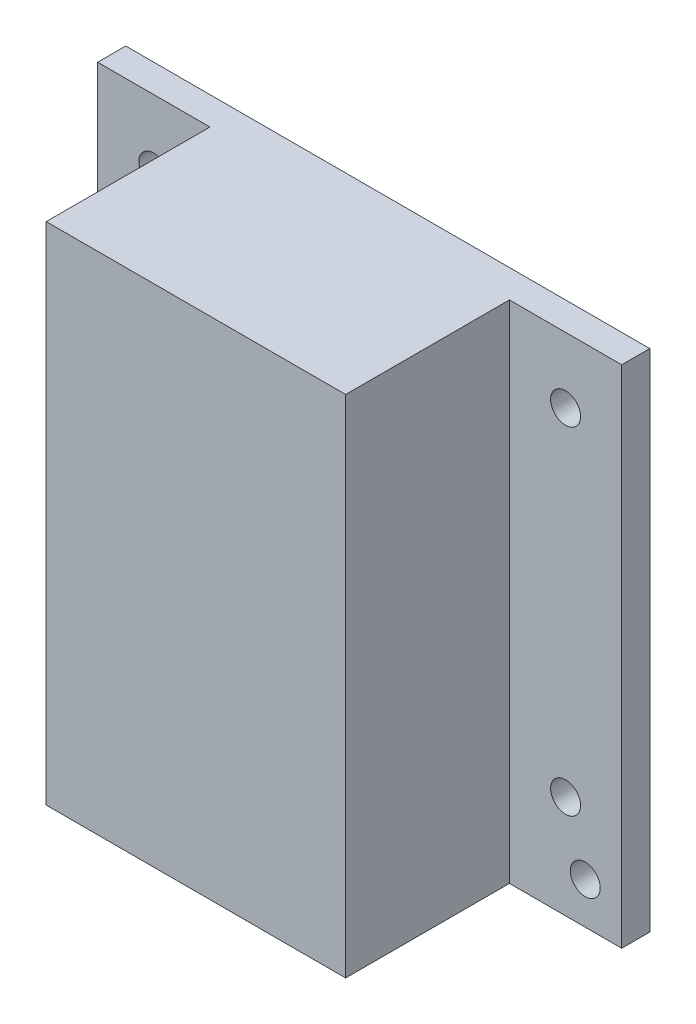
from build123d import *

# Parameters (mm, degrees)
SKETCH1_W           = 132
SKETCH1_H           = 160
BOSS_EXTRUDE1_DEPTH = 6
SKETCH3_W           = 32
SKETCH3_H           = 54
SKETCH3_W_2         = 26
SKETCH3_H_2         = 48
BOSS_EXTRUDE2_DEPTH = 17.5
SKETCH4_W           = 32
SKETCH4_H           = 54
BOSS_EXTRUDE3_DEPTH = 3
SKETCH5_W           = 25
SKETCH5_H           = 17
CUT_EXTRUDE1_DEPTH  = 3
SKETCH6_W           = 12
SKETCH6_H           = 54
BOSS_EXTRUDE4_DEPTH = 3
SKETCH7_R           = 1.6
CUT_EXTRUDE2_DEPTH  = 106.177231376
SKETCH8_W           = 3
SKETCH8_H           = 6.5
BOSS_EXTRUDE5_DEPTH = 20
SKETCH9_R           = 1.55
CUT_EXTRUDE3_DEPTH  = 6
SKETCH10_R          = 1.6
CUT_EXTRUDE4_DEPTH  = 108.043215572
SKETCH11_W          = 2.5
SKETCH11_H          = 7
BOSS_EXTRUDE6_DEPTH = 19.36
SKETCH12_R          = 1.6
CUT_EXTRUDE5_DEPTH  = 19.36
SKETCH13_W          = 3
SKETCH13_H          = 7
BOSS_EXTRUDE7_DEPTH = 15
SKETCH14_R          = 2
CUT_EXTRUDE6_DEPTH  = 15
CUT_EXTRUDE7_START  = -6
CUT_EXTRUDE7_DEPTH  = 6
SKETCH16_R          = 1.6
CUT_EXTRUDE8_DEPTH  = 15
SKETCH17_W          = 119.064494472
SKETCH17_H          = 144.515611373
CUT_EXTRUDE10_DEPTH = 61


# Read off the part's stored shape, not the designer's step: Cut-Extrude7
with BuildPart() as part:
    # Sketch1 → Boss-Extrude1 (new body)
    with BuildSketch(Plane.XY):
        Rectangle(SKETCH1_W, SKETCH1_H)
    extrude(amount=BOSS_EXTRUDE1_DEPTH)

    # Sketch3 → Boss-Extrude2 (add)
    with BuildSketch(Plane.XY.offset(6)):
        with Locations((0, -53)):
            Rectangle(SKETCH3_W, SKETCH3_H)
        with Locations((0, -53)):
            Rectangle(SKETCH3_W_2, SKETCH3_H_2, mode=Mode.SUBTRACT)
    extrude(amount=BOSS_EXTRUDE2_DEPTH)

    # Sketch4 → Boss-Extrude3 (add)
    with BuildSketch(Plane.XY.offset(23.5)):
        with Locations((0, -53)):
            Rectangle(SKETCH4_W, SKETCH4_H)
    extrude(amount=BOSS_EXTRUDE3_DEPTH)

    # Sketch5 → Cut-Extrude1 (cut)
    with BuildSketch(Plane.XZ.offset(80)):
        with Locations((0, 14.5)):
            Rectangle(SKETCH5_W, SKETCH5_H)
    extrude(amount=-CUT_EXTRUDE1_DEPTH, mode=Mode.SUBTRACT)

    # Sketch6 → Boss-Extrude4 (add)
    with BuildSketch(Plane.XY.offset(6)):
        with Locations((-22, -53)):
            Rectangle(SKETCH6_W, SKETCH6_H)
        with Locations((22, -53)):
            Rectangle(SKETCH6_W, SKETCH6_H)
    extrude(amount=BOSS_EXTRUDE4_DEPTH)

    # Sketch7 → Cut-Extrude2 (cut, through all)
    with BuildSketch(Plane.XY.offset(9)):
        with Locations((-22, -69)):
            Circle(SKETCH7_R)
        with Locations((-22, -33)):
            Circle(SKETCH7_R)
        with Locations(Location((22, -69, 0), (0, 0, 180))):
            Circle(SKETCH7_R)
        with Locations(Location((22, -33, 0), (0, 0, 180))):
            Circle(SKETCH7_R)
    extrude(amount=-CUT_EXTRUDE2_DEPTH, mode=Mode.SUBTRACT)

    # Sketch8 → Boss-Extrude5 (add)
    with BuildSketch(Plane.XY.offset(6)):
        with Locations((-54.38, -76.75)):
            Rectangle(SKETCH8_W, SKETCH8_H)
        with Locations((-54.38, -30.25)):
            Rectangle(SKETCH8_W, SKETCH8_H)
    boss_extrude5 = extrude(amount=BOSS_EXTRUDE5_DEPTH)

    # Sketch9 → Cut-Extrude3 (cut)
    with BuildSketch(Plane.ZY.offset(55.88)):
        with Locations((10.35, -76.75)):
            Circle(SKETCH9_R)
        with Locations((19.65, -76.75)):
            Circle(SKETCH9_R)
        with Locations((10.35, -30.25)):
            Circle(SKETCH9_R)
        with Locations((19.65, -30.25)):
            Circle(SKETCH9_R)
    cut_extrude3 = extrude(amount=-CUT_EXTRUDE3_DEPTH, mode=Mode.SUBTRACT)

    # Mirror1: Boss-Extrude5, Cut-Extrude3 across plane
    add(boss_extrude5.mirror(Plane(origin=(0, 0, 0), x_dir=(0, 0, 1), z_dir=(1, 0, 0))))
    add(cut_extrude3.mirror(Plane(origin=(0, 0, 0), x_dir=(0, 0, 1), z_dir=(1, 0, 0))), mode=Mode.SUBTRACT)

    # Sketch10 → Cut-Extrude4 (cut, through all)
    with BuildSketch(Plane(origin=(0, 0, 0), x_dir=(-1, 0, 0), z_dir=(0, 0, -1))):
        with Locations((-24.1, -75.572749788)):
            Circle(SKETCH10_R)
        with Locations((-21.15, -12.732749788)):
            Circle(SKETCH10_R)
        with Locations(Location((21.15, -12.732749788, 0), (0, 0, 180))):
            Circle(SKETCH10_R)
        with Locations((24.1, -75.572749788)):
            Circle(SKETCH10_R)
    extrude(amount=-CUT_EXTRUDE4_DEPTH, mode=Mode.SUBTRACT)

    # Sketch11 → Boss-Extrude6 (add)
    with BuildSketch(Plane(origin=(0, 0, 0), x_dir=(-1, 0, 0), z_dir=(0, 0, -1))):
        with Locations((-17.9, 1.267250212)):
            Rectangle(SKETCH11_W, SKETCH11_H)
        with Locations((-17.9, 50.267250212)):
            Rectangle(SKETCH11_W, SKETCH11_H)
    extrude(amount=BOSS_EXTRUDE6_DEPTH)

    # Sketch12 → Cut-Extrude5 (cut)
    with BuildSketch(Plane(origin=(19.15, 0, 0), x_dir=(0, 0, -1), z_dir=(1, 0, 0))):
        with Locations(Location((4.5, 50.267250212, 0), (0, 0, 90))):
            Circle(SKETCH12_R)
        with Locations(Location((14.5, 50.267250212, 0), (0, 0, 90))):
            Circle(SKETCH12_R)
        with Locations(Location((4.5, 1.267250212, 0), (0, 0, 90))):
            Circle(SKETCH12_R)
        with Locations(Location((14.5, 1.267250212, 0), (0, 0, 90))):
            Circle(SKETCH12_R)
    extrude(amount=-CUT_EXTRUDE5_DEPTH, mode=Mode.SUBTRACT)

    # Sketch13 → Boss-Extrude7 (add)
    with BuildSketch(Plane(origin=(0, 0, 0), x_dir=(-1, 0, 0), z_dir=(0, 0, -1))):
        with Locations((29.35, 35.967250212)):
            Rectangle(SKETCH13_W, SKETCH13_H)
    extrude(amount=BOSS_EXTRUDE7_DEPTH)

    # Sketch14 → Cut-Extrude6 (cut)
    with BuildSketch(Plane.ZY.offset(30.85)):
        with Locations((-9.9, 35.967250212)):
            Circle(SKETCH14_R)
    extrude(amount=-CUT_EXTRUDE6_DEPTH, mode=Mode.SUBTRACT)

    # Cut-Extrude7 outline → Cut-Extrude7 (cut)
    with BuildSketch(Plane(origin=(0, 0, 0), x_dir=(-1, 0, 0), z_dir=(0, 0, -1)).offset(CUT_EXTRUDE7_START)):
        Polygon((-30.85, 56.767250212), (30.85, 56.767250212), (30.85, -24), (58.88, -24), (58.88, -80), (66, -80), (66, 80), (-66, 80), (-66, -80), (-58.88, -80), (-58.88, -24), (-30.85, -24), align=None)
    extrude(amount=CUT_EXTRUDE7_DEPTH, mode=Mode.SUBTRACT)

    # Sketch16 → Cut-Extrude8 (cut)
    with BuildSketch(Plane(origin=(0, 0, 0), x_dir=(-1, 0, 0), z_dir=(0, 0, -1))):
        Circle(SKETCH16_R)
        with Locations((0, 52.767250212)):
            Circle(SKETCH16_R)
    extrude(amount=-CUT_EXTRUDE8_DEPTH, mode=Mode.SUBTRACT)

    # Sketch17 → Cut-Extrude10 (cut)
    with BuildSketch(Plane.XY.offset(6)):
        with Locations((0.652247236, -7.742194314)):
            Rectangle(SKETCH17_W, SKETCH17_H)
    extrude(amount=-CUT_EXTRUDE10_DEPTH, mode=Mode.SUBTRACT)


with BuildPart() as body_2:
    # of the pieces the cut leaves, the one that is kept (cut_extrude10_keep)
    add(part.part.solids().sort_by_distance((12.5, -80, 6))[0])


solid = body_2.part
